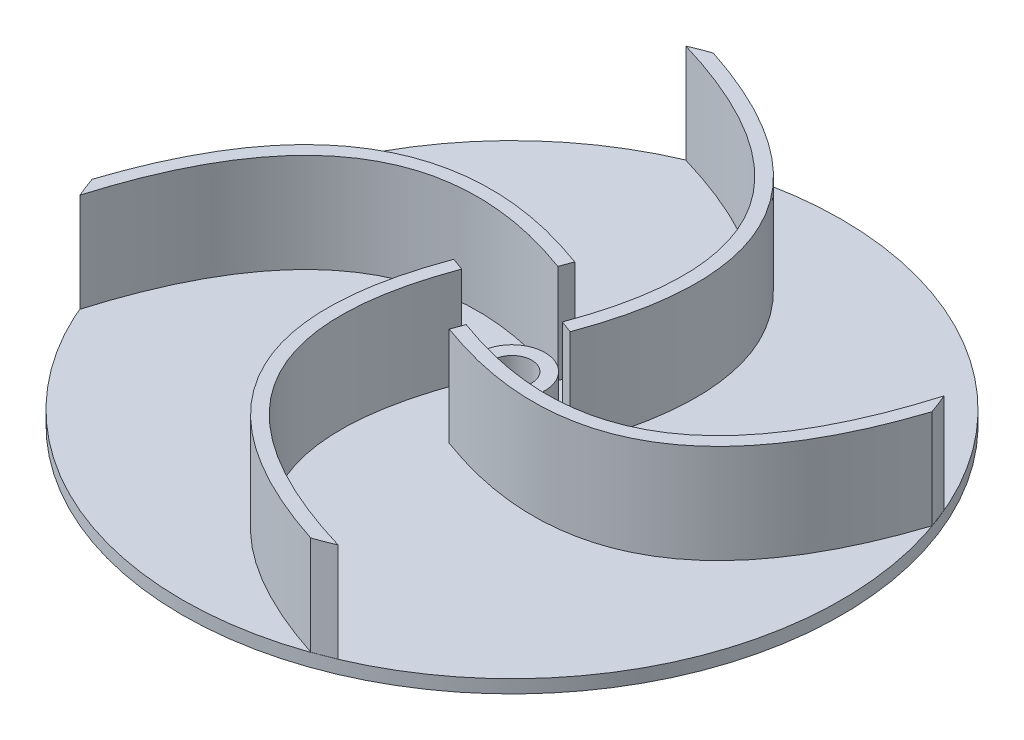
from build123d import *

# Parameters (mm, degrees)
SKETCH1_R           = 50
BOSS_EXTRUDE1_DEPTH = 2
SKETCH2_R           = 5
BOSS_EXTRUDE2_DEPTH = 7
CUT_EXTRUDE2_DEPTH  = 72.056315694
BOSS_EXTRUDE4_DEPTH = 15
CIRPATTERN1_COUNT   = 4


with BuildPart() as part:
    # Sketch1 → Boss-Extrude1 (new body)
    with BuildSketch(Plane(origin=(0, 0, 0), x_dir=(1, 0, 0), z_dir=(0, 1, 0))):
        Circle(SKETCH1_R)
    extrude(amount=BOSS_EXTRUDE1_DEPTH)

    # Sketch2 → Boss-Extrude2 (add)
    with BuildSketch(Plane(origin=(0, 0, 0), x_dir=(1, 0, 0), z_dir=(0, 1, 0))):
        Circle(SKETCH2_R)
    extrude(amount=BOSS_EXTRUDE2_DEPTH)

    # Sketch4 → Cut-Extrude2 (cut, through all)
    with BuildSketch(Plane(origin=(0, 0, 0), x_dir=(1, 0, 0), z_dir=(0, 1, 0))):
        with BuildLine():
            Line((-2.598076211, -1.5), (2.598076211, -1.5))
            ThreePointArc((2.598076211, -1.5), (0, 3), (-2.598076211, -1.5))
        make_face()
    extrude(amount=CUT_EXTRUDE2_DEPTH, mode=Mode.SUBTRACT)

    # Sketch3 → Boss-Extrude4 (add)
    with BuildSketch(Plane(origin=(0, 2, 0), x_dir=(1, 0, 0), z_dir=(0, 1, 0))):
        with BuildLine():
            add(Edge.make_bspline(
                [(0.347159075, 9.174332074), (-2.272335511, 10.14402204), (-9.778455109, 12.176220665), (-18.858666275, 12.516838136), (-26.98332215, 10.437827062), (-35.834094835, 4.80560362), (-43.192371454, -6.058924014), (-46.447938168, -14.509198638), (-47.125901534, -16.588620614)],
                knots=[0, 0, 0, 0.0625, 0.1875, 0.3125, 0.4375, 0.625, 0.776075834, 0.820860668, 0.820860668, 0.820860668], degree=2))
            ThreePointArc((-47.125901534, -16.588620614), (-46.568099122, -18.095443444), (-45.962131106, -19.583550072))
            add(Edge.make_bspline(
                [(-0.347159075, 7.298719559), (-2.888403982, 8.239442896), (-10.11301379, 10.191449748), (-18.669800338, 10.504349), (-26.1781872, 8.57811334), (-34.363630297, 3.380369067), (-42.058285466, -7.930693426), (-45.424935602, -17.767650313), (-45.962131106, -19.583550072)],
                knots=[0, 0, 0, 0.0625, 0.1875, 0.3125, 0.4375, 0.625, 0.808104002, 0.846483201, 0.846483201, 0.846483201], degree=2))
            Line((-0.347159075, 7.298719559), (0.347159075, 9.174332074))
        make_face()
    boss_extrude4 = extrude(amount=BOSS_EXTRUDE4_DEPTH)

    # CirPattern1: Boss-Extrude4 ×4 about axis
    cirpattern1_axis = Axis((0, 7, 0), (0, 1, 0))
    for i in range(1, CIRPATTERN1_COUNT):
        add(boss_extrude4.rotate(cirpattern1_axis, i * 360 / CIRPATTERN1_COUNT))


solid = part.part
